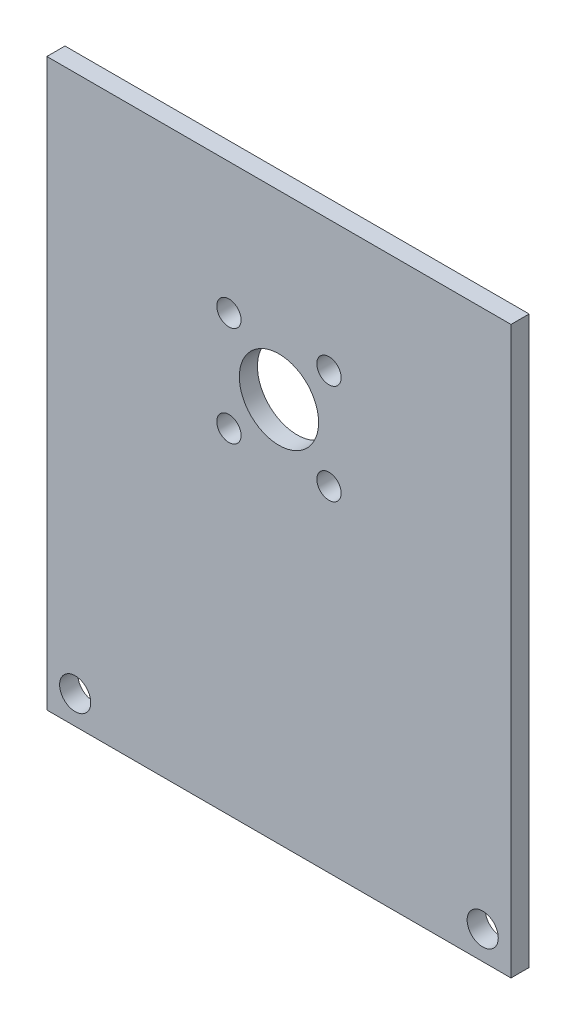
from build123d import *

# Parameters (mm, degrees)
SKETCH1_W           = 150
SKETCH1_H           = 160
BOSS_EXTRUDE1_DEPTH = 3.2
CUT_EXTRUDE1_REACH  = 111.705
SKETCH2_R           = 7
SKETCH2_R_2         = 2.75
SKETCH3_R           = 2.15
CUT_EXTRUDE2_DEPTH  = 110.705241443
CIRPATTERN1_COUNT   = 4
SKETCH5_OUTSIDE_W   = 195.868
SKETCH5_OUTSIDE_H   = 205.868
SKETCH5_OUTSIDE_W_2 = 82
SKETCH5_OUTSIDE_H_2 = 100
CUT_EXTRUDE4_DEPTH  = 10


with BuildPart() as part:
    # Sketch1 → Boss-Extrude1 (new body)
    with BuildSketch(Plane.XY):
        Rectangle(SKETCH1_W, SKETCH1_H)
    extrude(amount=BOSS_EXTRUDE1_DEPTH)

    # Sketch2 → Cut-Extrude1 (cut, up to next)
    with BuildSketch(Plane.XY.offset(3.2), mode=Mode.PRIVATE) as cut_extrude1_sk1:
        with Locations((0, -12)):
            Circle(SKETCH2_R)
    cut_extrude1_tool1 = extrude(cut_extrude1_sk1.sketch, amount=-CUT_EXTRUDE1_REACH, mode=Mode.PRIVATE) & part.part
    # Sketch2 → Cut-Extrude1 (cut, up to next)
    with BuildSketch(Plane.XY.offset(3.2), mode=Mode.PRIVATE) as cut_extrude1_sk2:
        with Locations((-36, -75)):
            Circle(SKETCH2_R_2)
    cut_extrude1_tool2 = extrude(cut_extrude1_sk2.sketch, amount=-CUT_EXTRUDE1_REACH, mode=Mode.PRIVATE) & part.part
    # Sketch2 → Cut-Extrude1 (cut, up to next)
    with BuildSketch(Plane.XY.offset(3.2), mode=Mode.PRIVATE) as cut_extrude1_sk3:
        with Locations((36, -75)):
            Circle(SKETCH2_R_2)
    cut_extrude1_tool3 = extrude(cut_extrude1_sk3.sketch, amount=-CUT_EXTRUDE1_REACH, mode=Mode.PRIVATE) & part.part
    add(cut_extrude1_tool1.solids().sort_by_distance((0, -12, 3.2))[0], mode=Mode.SUBTRACT)
    add(cut_extrude1_tool2.solids().sort_by_distance((-36, -75, 3.2))[0], mode=Mode.SUBTRACT)
    add(cut_extrude1_tool3.solids().sort_by_distance((36, -75, 3.2))[0], mode=Mode.SUBTRACT)

    # Sketch3 → Cut-Extrude2 (cut, through all)
    with BuildSketch(Plane.XY.offset(3.2)):
        with Locations((-8.838834765, -3.161165235)):
            Circle(SKETCH3_R)
    cut_extrude2 = extrude(amount=-CUT_EXTRUDE2_DEPTH, mode=Mode.SUBTRACT)

    # CirPattern1: Cut-Extrude2 ×4 about axis
    cirpattern1_axis = Axis((0, -12, 3.2), (0, 0, 1))
    for i in range(1, CIRPATTERN1_COUNT):
        add(cut_extrude2.rotate(cirpattern1_axis, i * 360 / CIRPATTERN1_COUNT), mode=Mode.SUBTRACT)

    # Sketch5 outside → Cut-Extrude4 (cut)
    with BuildSketch(Plane.XY.offset(3.2)):
        Rectangle(SKETCH5_OUTSIDE_W, SKETCH5_OUTSIDE_H)
        with Locations((0, -30)):
            Rectangle(SKETCH5_OUTSIDE_W_2, SKETCH5_OUTSIDE_H_2, mode=Mode.SUBTRACT)
    extrude(amount=-CUT_EXTRUDE4_DEPTH, mode=Mode.SUBTRACT)


solid = part.part
